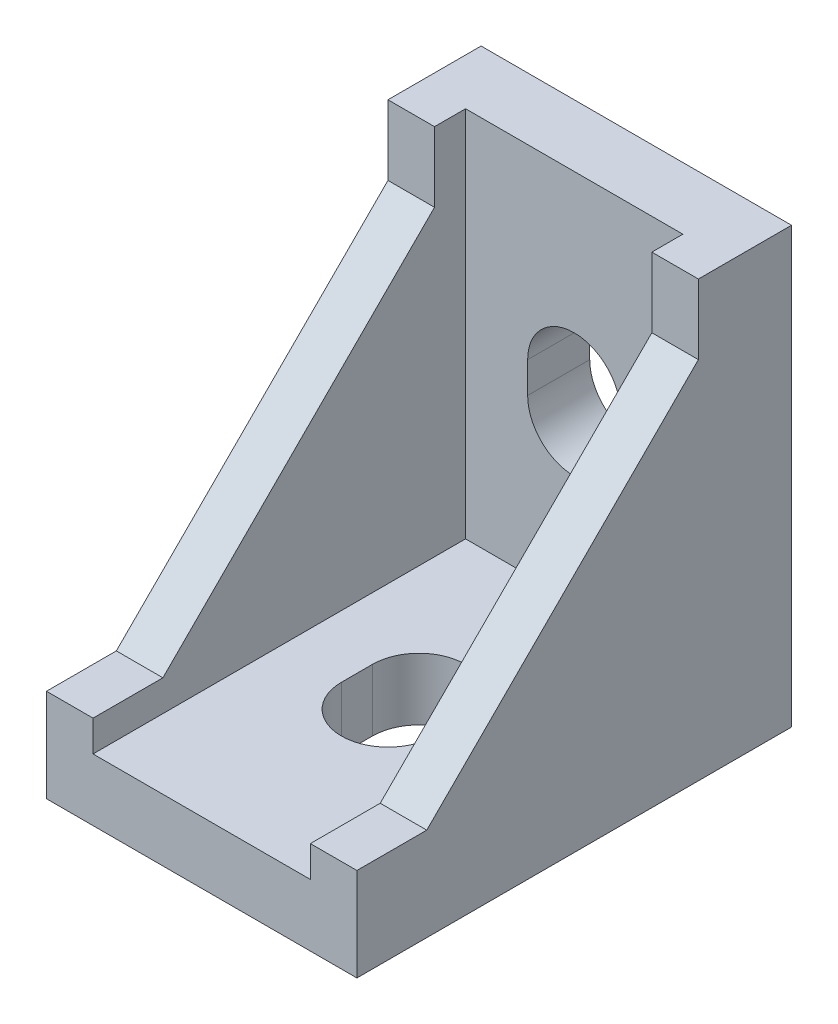
from build123d import *

# Parameters (mm, degrees)
SKETCH1_W           = 20
SKETCH1_H           = 28
BOSS_EXTRUDE1_DEPTH = 4
CUT_EXTRUDE1_DEPTH  = 18.663521733
SKETCH4_W           = 6
SKETCH4_H           = 2
BOSS_EXTRUDE2_DEPTH = 1.25
BOSS_EXTRUDE3_DEPTH = 3


with BuildPart() as part:
    # Sketch1 → Boss-Extrude1 (new body)
    with BuildSketch(Plane(origin=(0, 0, 0), x_dir=(1, 0, 0), z_dir=(0, 1, 0))):
        Rectangle(SKETCH1_W, SKETCH1_H)
    boss_extrude1 = extrude(amount=BOSS_EXTRUDE1_DEPTH)

    # Sketch3 → Cut-Extrude1 (cut, through all)
    with BuildSketch(Plane(origin=(0, 4, 0), x_dir=(1, 0, 0), z_dir=(0, 1, 0))):
        with BuildLine():
            Line((3, 0), (3, -2))
            ThreePointArc((3, -2), (0, -5), (-3, -2))
            Line((-3, -2), (-3, 0))
            ThreePointArc((-3, 0), (0, 3), (3, 0))
        make_face()
    cut_extrude1 = extrude(amount=-CUT_EXTRUDE1_DEPTH, mode=Mode.SUBTRACT)

    # Sketch4 → Boss-Extrude2 (add)
    with BuildSketch(Plane.XZ):
        with Locations((0, 11.1)):
            Rectangle(SKETCH4_W, SKETCH4_H)
        with Locations((0, -11)):
            Rectangle(SKETCH4_W, SKETCH4_H)
    boss_extrude2 = extrude(amount=BOSS_EXTRUDE2_DEPTH)

    # Mirror1: Boss-Extrude1, Cut-Extrude1, Boss-Extrude2 across plane
    add(boss_extrude1.mirror(Plane(origin=(0, 7, -7), x_dir=(0, 0.7071067811865478, 0.7071067811865472), z_dir=(0, -0.7071067811865475, 0.7071067811865477))))
    add(cut_extrude1.mirror(Plane(origin=(0, 7, -7), x_dir=(0, 0.7071067811865478, 0.7071067811865472), z_dir=(0, -0.7071067811865475, 0.7071067811865477))), mode=Mode.SUBTRACT)
    add(boss_extrude2.mirror(Plane(origin=(0, 7, -7), x_dir=(0, 0.7071067811865478, 0.7071067811865472), z_dir=(0, -0.7071067811865475, 0.7071067811865477))))

    # Sketch5 → Boss-Extrude3 (add)
    with BuildSketch(Plane(origin=(10, 0, 0), x_dir=(0, 0, -1), z_dir=(1, 0, 0))):
        Polygon((-14, 4), (-14, 6), (-9.5, 6), (8, 23.5), (8, 28), (10, 28), (10, 4), align=None)
    boss_extrude3 = extrude(amount=-BOSS_EXTRUDE3_DEPTH)

    # Mirror2: Boss-Extrude3 across plane
    add(boss_extrude3.mirror(Plane(origin=(0, 0, 0), x_dir=(0, 0, 1), z_dir=(1, 0, 0))))


solid = part.part
